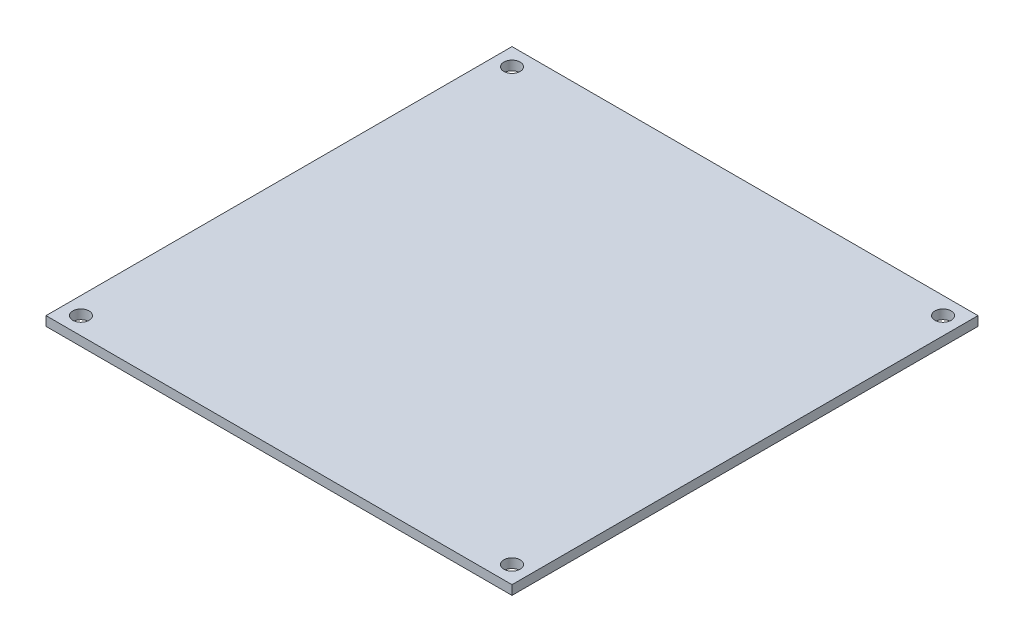
from build123d import *

# Parameters (mm, degrees)
SKETCH_2_W      = 100
SKETCH_2_H      = 100
SKETCH_2_R      = 1.75
EXTRUDE_1_DEPTH = 2


with BuildPart() as part:
    # 스케치2 → 보스-돌출1 (new body)
    with BuildSketch(Plane(origin=(0, 0, 0), x_dir=(1, 0, 0), z_dir=(0, 1, 0))):
        Rectangle(SKETCH_2_W, SKETCH_2_H)
        with Locations((-46.25, 46.25)):
            Circle(SKETCH_2_R, mode=Mode.SUBTRACT)
        with Locations((46.25, 46.25)):
            Circle(SKETCH_2_R, mode=Mode.SUBTRACT)
        with Locations((46.25, -46.25)):
            Circle(SKETCH_2_R, mode=Mode.SUBTRACT)
        with Locations((-46.25, -46.25)):
            Circle(SKETCH_2_R, mode=Mode.SUBTRACT)
    extrude(amount=EXTRUDE_1_DEPTH)


solid = part.part
